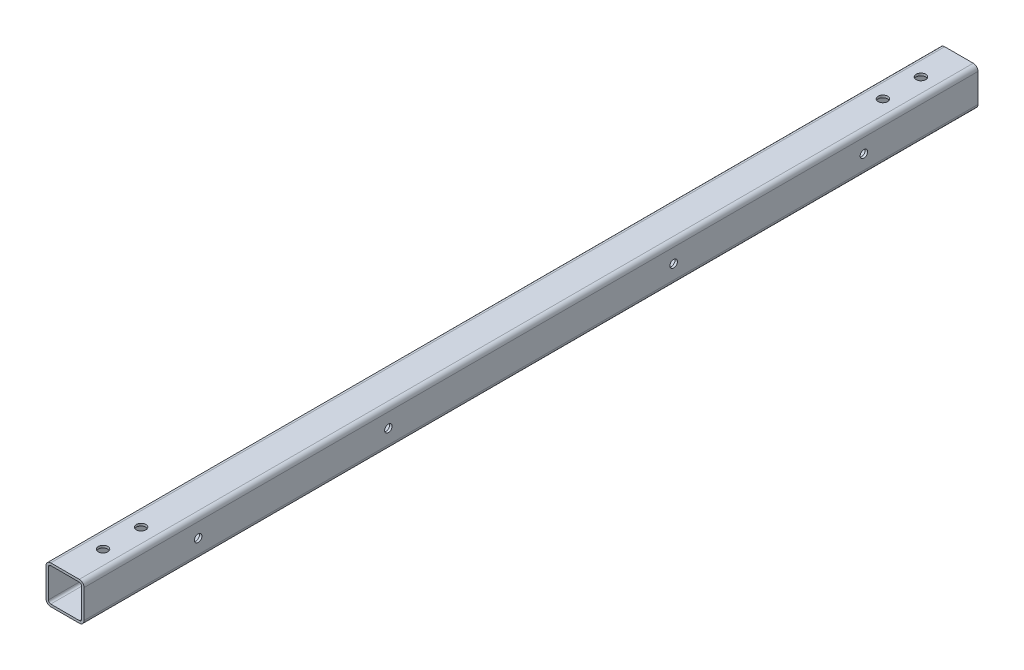
from build123d import *

# Parameters (mm, degrees)
SKETCH1_W          = 25.4
SKETCH1_H          = 25.4
BASE_EXTRUDE_DEPTH = 298.45
FILLET1_R          = 3.175
SHELL1_T           = -1.5875
SKETCH4_R          = 3.175
CUT_EXTRUDE1_DEPTH = 300.798019506
CUT_EXTRUDE3_REACH = 301.668
SKETCH6_R          = 2.5


with BuildPart() as part:
    # Sketch1 → Base-Extrude (new, symmetric)
    with BuildSketch(Plane.XY):
        Rectangle(SKETCH1_W, SKETCH1_H)
    extrude(amount=BASE_EXTRUDE_DEPTH, both=True)

    # Fillet1
    fillet1_edges = [part.edges().sort_by_distance(p)[0] for p in [
        (-12.7, 12.7, 0),
        (-12.7, -12.7, 0),
        (12.7, 12.7, 0),
        (12.7, -12.7, 0),
    ]]
    fillet(fillet1_edges, radius=FILLET1_R)

    # Shell1
    shell1_openings = [part.faces().sort_by_distance(p)[0] for p in [
        (0, 0, -298.45),
        (0, 0, 298.45),
    ]]
    offset(amount=SHELL1_T, openings=shell1_openings, kind=Kind.INTERSECTION)

    # Sketch4 → Cut-Extrude1 (cut, through all)
    with BuildSketch(Plane.XZ.offset(12.7)):
        with Locations((0, 273.05)):
            Circle(SKETCH4_R)
        with Locations((0, 247.65)):
            Circle(SKETCH4_R)
        with Locations((0, -247.65)):
            Circle(SKETCH4_R)
        with Locations((0, -273.05)):
            Circle(SKETCH4_R)
    extrude(amount=-CUT_EXTRUDE1_DEPTH, mode=Mode.SUBTRACT)

    # Sketch6 → Cut-Extrude3 (cut, up to next)
    with BuildSketch(Plane.ZY.offset(-11.1125), mode=Mode.PRIVATE) as cut_extrude3_sk1:
        with Locations((-95.25, 0)):
            Circle(SKETCH6_R)
    cut_extrude3_tool1 = extrude(cut_extrude3_sk1.sketch, amount=-CUT_EXTRUDE3_REACH, mode=Mode.PRIVATE) & part.part
    # Sketch6 → Cut-Extrude3 (cut, up to next)
    with BuildSketch(Plane.ZY.offset(-11.1125), mode=Mode.PRIVATE) as cut_extrude3_sk2:
        with Locations((-222.25, 0)):
            Circle(SKETCH6_R)
    cut_extrude3_tool2 = extrude(cut_extrude3_sk2.sketch, amount=-CUT_EXTRUDE3_REACH, mode=Mode.PRIVATE) & part.part
    # Sketch6 → Cut-Extrude3 (cut, up to next)
    with BuildSketch(Plane.ZY.offset(-11.1125), mode=Mode.PRIVATE) as cut_extrude3_sk3:
        with Locations((222.25, 0)):
            Circle(SKETCH6_R)
    cut_extrude3_tool3 = extrude(cut_extrude3_sk3.sketch, amount=-CUT_EXTRUDE3_REACH, mode=Mode.PRIVATE) & part.part
    # Sketch6 → Cut-Extrude3 (cut, up to next)
    with BuildSketch(Plane.ZY.offset(-11.1125), mode=Mode.PRIVATE) as cut_extrude3_sk4:
        with Locations((95.25, 0)):
            Circle(SKETCH6_R)
    cut_extrude3_tool4 = extrude(cut_extrude3_sk4.sketch, amount=-CUT_EXTRUDE3_REACH, mode=Mode.PRIVATE) & part.part
    add(cut_extrude3_tool1.solids().sort_by_distance((11.1125, 0, -95.25))[0], mode=Mode.SUBTRACT)
    add(cut_extrude3_tool2.solids().sort_by_distance((11.1125, 0, -222.25))[0], mode=Mode.SUBTRACT)
    add(cut_extrude3_tool3.solids().sort_by_distance((11.1125, 0, 222.25))[0], mode=Mode.SUBTRACT)
    add(cut_extrude3_tool4.solids().sort_by_distance((11.1125, 0, 95.25))[0], mode=Mode.SUBTRACT)


solid = part.part
